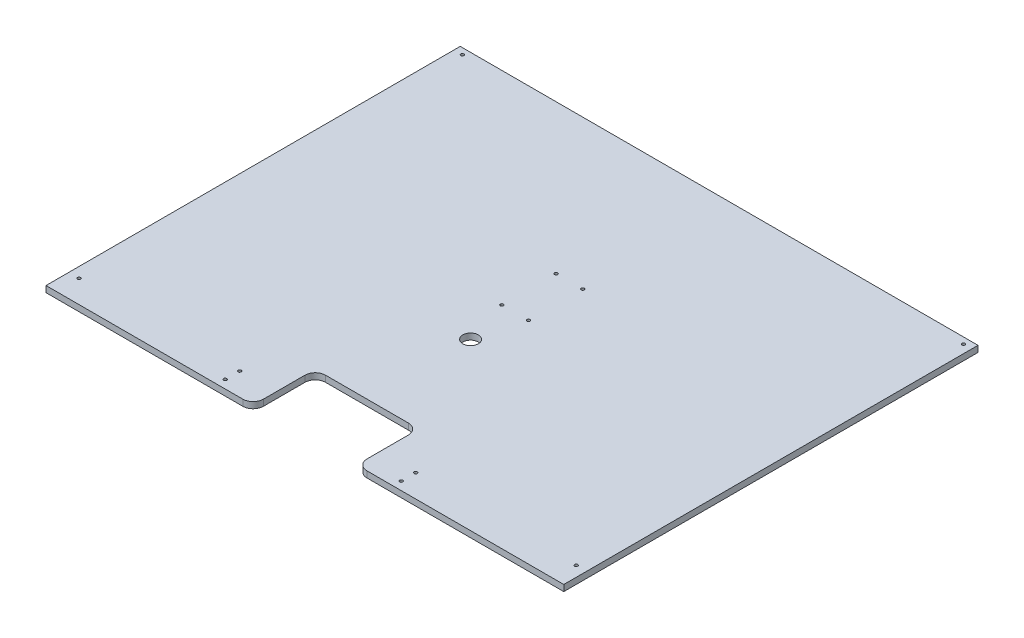
from build123d import *

# Parameters (mm, degrees)
SKETCH1_W           = 500
SKETCH1_H           = 400
SKETCH1_R           = 1.5
SKETCH1_R_2         = 1.525
BOSS_EXTRUDE1_DEPTH = 6
SKETCH2_R           = 1.5
CUT_EXTRUDE1_DEPTH  = 10
SKETCH3_R           = 7.5
SKETCH3_W           = 100
SKETCH3_H           = 60
CUT_EXTRUDE2_DEPTH  = 641.340534403
FILLET1_R           = 10


with BuildPart() as part:
    # Sketch1 → Boss-Extrude1 (new body)
    with BuildSketch(Plane(origin=(0, 0, 0), x_dir=(1, 0, 0), z_dir=(0, 1, 0))):
        with Locations((250, -200)):
            Rectangle(SKETCH1_W, SKETCH1_H)
        with Locations((490, -378)):
            Circle(SKETCH1_R, mode=Mode.SUBTRACT)
        with Locations((10, -378)):
            Circle(SKETCH1_R, mode=Mode.SUBTRACT)
        with Locations((8, -6)):
            Circle(SKETCH1_R, mode=Mode.SUBTRACT)
        with Locations((492, -6)):
            Circle(SKETCH1_R_2, mode=Mode.SUBTRACT)
        with Locations((236.4, -196.155149351)):
            Circle(SKETCH1_R, mode=Mode.SUBTRACT)
        with Locations((262.1, -196.155149351)):
            Circle(SKETCH1_R, mode=Mode.SUBTRACT)
        with Locations((262.1, -143.855149351)):
            Circle(SKETCH1_R, mode=Mode.SUBTRACT)
        with Locations((236.4, -143.855149351)):
            Circle(SKETCH1_R, mode=Mode.SUBTRACT)
    extrude(amount=BOSS_EXTRUDE1_DEPTH)

    # Sketch2 → Cut-Extrude1 (cut)
    with BuildSketch(Plane(origin=(0, 6, 0), x_dir=(1, 0, 0), z_dir=(0, 1, 0))):
        with Locations((165, -378)):
            Circle(SKETCH2_R)
        with Locations((165, -392)):
            Circle(SKETCH2_R)
        with Locations((335, -378)):
            Circle(SKETCH2_R)
        with Locations((335, -392)):
            Circle(SKETCH2_R)
    extrude(amount=-CUT_EXTRUDE1_DEPTH, mode=Mode.SUBTRACT)

    # Sketch3 → Cut-Extrude2 (cut, through all)
    with BuildSketch(Plane.XZ):
        with Locations((250, 240)):
            Circle(SKETCH3_R)
        with Locations((250, 370)):
            Rectangle(SKETCH3_W, SKETCH3_H)
    extrude(amount=-CUT_EXTRUDE2_DEPTH, mode=Mode.SUBTRACT)

    # Fillet1
    fillet1_edges = [part.edges().sort_by_distance(p)[0] for p in [
        (200, 3, 400),
        (300, 3, 400),
        (200, 3, 340),
        (300, 3, 340),
    ]]
    fillet(fillet1_edges, radius=FILLET1_R)


solid = part.part
